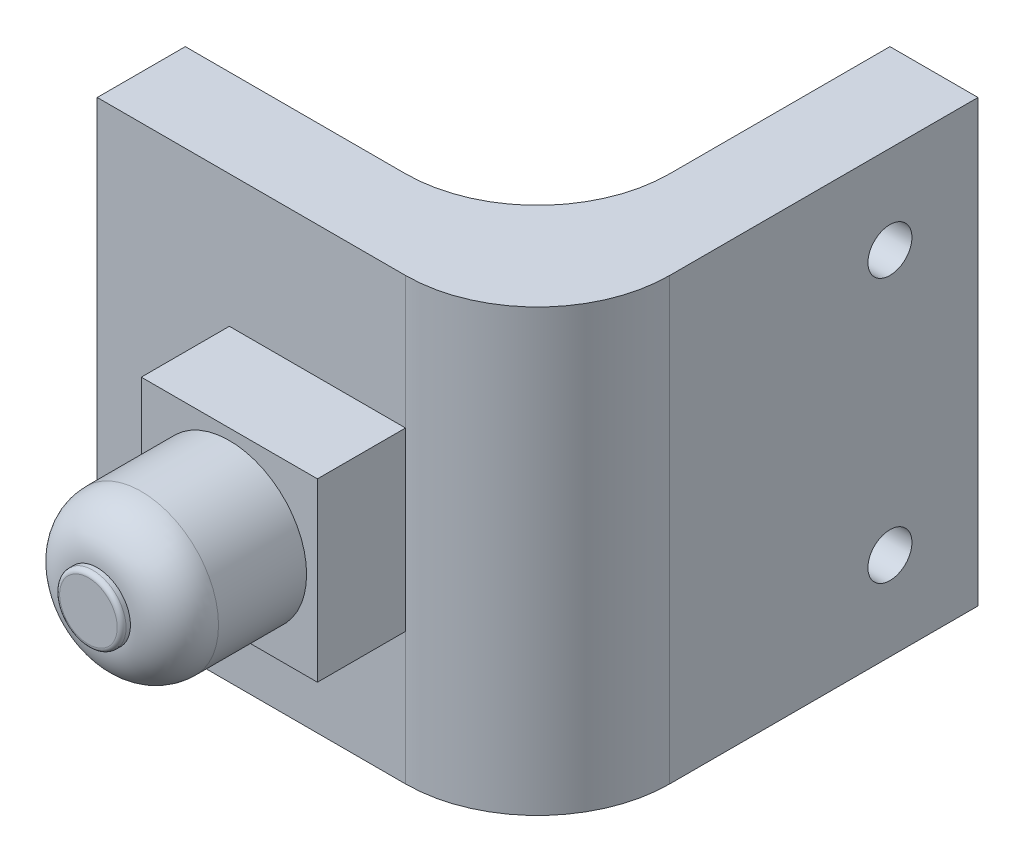
from build123d import *

# Parameters (mm, degrees)
BOSS_EXTRUDE1_DEPTH = 50
SKETCH2_R           = 2.5
CUT_EXTRUDE2_DEPTH  = 50
SKETCH3_W           = 20
SKETCH3_H           = 20
BOSS_EXTRUDE2_DEPTH = 10
SKETCH4_R           = 8.769113897
BOSS_EXTRUDE3_DEPTH = 15
FILLET1_R           = 5
FILLET2_R           = 15
FILLET3_R           = 15
SKETCH7_R           = 3.769113897
BOSS_EXTRUDE4_DEPTH = 1
FILLET5_R           = 0.5


with BuildPart() as part:
    # Sketch1 → Boss-Extrude1 (new body)
    with BuildSketch(Plane(origin=(0, 0, 0), x_dir=(1, 0, 0), z_dir=(0, 1, 0))):
        Polygon((0, 0), (50, 0), (50, 50), (40, 50), (40, 10), (0, 10), align=None)
    extrude(amount=BOSS_EXTRUDE1_DEPTH)

    # Sketch2 → Cut-Extrude2 (cut)
    with BuildSketch(Plane.ZY.offset(-40)):
        with Locations((-40, 10)):
            Circle(SKETCH2_R)
        with Locations((-40, 40)):
            Circle(SKETCH2_R)
    extrude(amount=-CUT_EXTRUDE2_DEPTH, mode=Mode.SUBTRACT)

    # Sketch3 → Boss-Extrude2 (add)
    with BuildSketch(Plane.XY):
        with Locations((25, 25)):
            Rectangle(SKETCH3_W, SKETCH3_H)
    extrude(amount=BOSS_EXTRUDE2_DEPTH)

    # Sketch4 → Boss-Extrude3 (add)
    with BuildSketch(Plane.XY.offset(10)):
        with Locations((25, 25)):
            Circle(SKETCH4_R)
    extrude(amount=BOSS_EXTRUDE3_DEPTH)

    # Fillet1
    fillet1_edges = [part.edges().sort_by_distance(p)[0] for p in [
        (16.230886103, 25, 25),
    ]]
    fillet(fillet1_edges, radius=FILLET1_R)

    # Fillet2
    fillet2_edges = [part.edges().sort_by_distance(p)[0] for p in [
        (40, 25, -10),
    ]]
    fillet(fillet2_edges, radius=FILLET2_R)

    # Fillet3
    fillet3_edges = [part.edges().sort_by_distance(p)[0] for p in [
        (50, 25, 0),
    ]]
    fillet(fillet3_edges, radius=FILLET3_R - 0.0001)  # a hair under: the kernel refuses the full size

    # Sketch7 → Boss-Extrude4 (add)
    with BuildSketch(Plane.XY.offset(25)):
        with Locations((25, 25)):
            Circle(SKETCH7_R)
    extrude(amount=BOSS_EXTRUDE4_DEPTH)

    # Fillet5
    fillet5_edges = [part.edges().sort_by_distance(p)[0] for p in [
        (21.230886103, 25, 26),
    ]]
    fillet(fillet5_edges, radius=FILLET5_R)


solid = part.part
